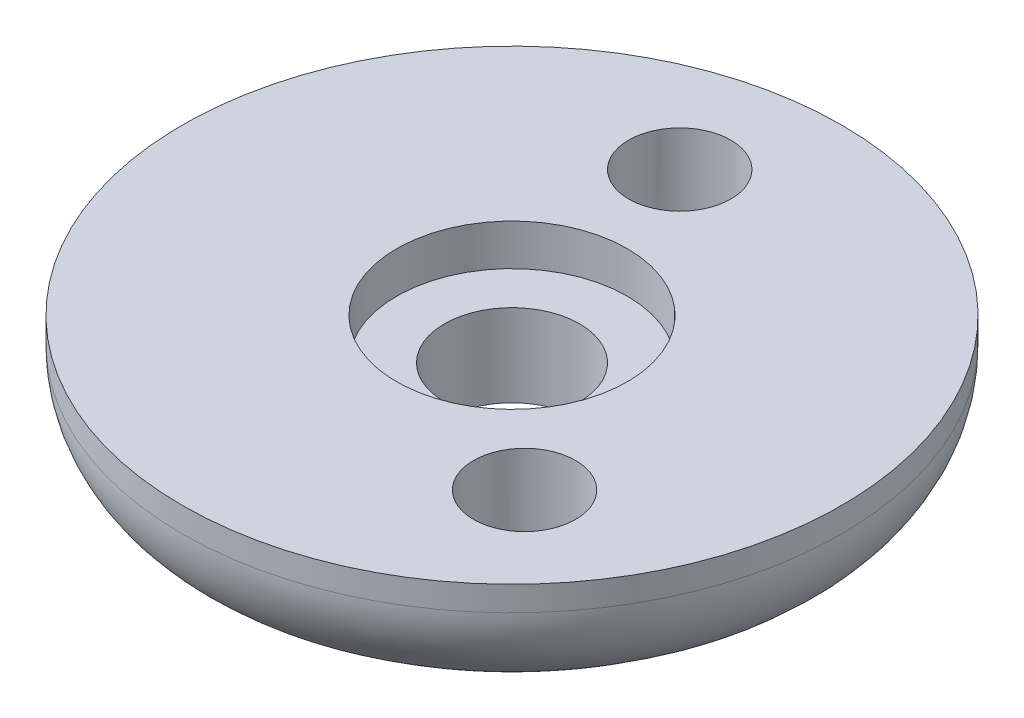
from build123d import *

# Parameters (mm, degrees)
BOSS_EXTRUDE1_DEPTH        = 3
BOSS_EXTRUDE1_DEPTH_BACK   = 10
SKETCH1_R                  = 10
SKETCH4_R                  = 1.5
HOLE_DEPTH                 = 20.973741561
HOLECIR_COUNT              = 5
SKETCH6_R                  = 3.5
BEARINGHOLE_DEPTH          = 2.5
SKETCH7_R                  = 2.05
SHAFTHOLE_DEPTH            = 17.248076982
F_3_1_3_1_DIAMETER_HOLE1_D = 3.1
FILLET2_R                  = 3
SKETCH11_R                 = 10
CUT_EXTRUDE1_DEPTH         = 10


with BuildPart() as part:
    # Sketch1 → Boss-Extrude1 (new, two sides: drawn at the far end of the back side and taken through both)
    with BuildSketch(Plane(origin=(0, 0, 0), x_dir=(1, 0, 0), z_dir=(0, 1, 0)).offset(-BOSS_EXTRUDE1_DEPTH_BACK)):
        with Locations(Location((0, 0, 0), (0, 0, 270))):
            Circle(SKETCH1_R)
    extrude(amount=BOSS_EXTRUDE1_DEPTH + BOSS_EXTRUDE1_DEPTH_BACK)

    # Sketch4 → hole (cut, through all)
    with BuildSketch(Plane(origin=(-3.352872105, -1.093066116, 1.887711608), x_dir=(-0.4486862613641547, -0.14627571033740308, -0.8816371449912632), z_dir=(0.8382180262940947, 0.2732665289126682, -0.47192790187872385))):
        with Locations(Location((0, 0, 0), (0, 0, 8.746528197))):
            Circle(SKETCH4_R)
    hole = extrude(amount=-HOLE_DEPTH, mode=Mode.SUBTRACT)

    # holecir: hole ×5 about axis
    holecir_axis = Axis((0, 0, 0), (0, 1, 0))
    for i in range(1, HOLECIR_COUNT):
        add(hole.rotate(holecir_axis, i * 360 / HOLECIR_COUNT), mode=Mode.SUBTRACT)

    # Sketch6 → bearinghole (cut)
    with BuildSketch(Plane(origin=(0, -5, 0), x_dir=(-1, 0, 0), z_dir=(0, -1, 0))):
        with Locations(Location((0, 0, 0), (0, 0, 90))):
            Circle(SKETCH6_R)
    extrude(amount=BEARINGHOLE_DEPTH, mode=Mode.SUBTRACT)

    # Sketch7 → shafthole (cut, through all)
    with BuildSketch(Plane(origin=(0, -5, 0), x_dir=(-1, 0, 0), z_dir=(0, -1, 0))):
        with Locations(Location((0, 0, 0), (0, 0, 90))):
            Circle(SKETCH7_R)
    extrude(amount=SHAFTHOLE_DEPTH, mode=Mode.SUBTRACT)

    # Ø3.1 (3.1) Diameter Hole1 (through all)
    with Locations(Plane(origin=(0, 3, 0), x_dir=(1, 0, 0), z_dir=(0, 1, 0))):
        with Locations((-1.282558474, 6.372208703), (4.783101903, -4.401356176)):
            Hole(F_3_1_3_1_DIAMETER_HOLE1_D / 2)

    # Fillet2
    # the kernel refuses this fillet: 3 mm, written as the material it takes off along each edge
    with BuildSketch(Plane(origin=(0, 3, 0), x_dir=(0, 0, 1), z_dir=(-1, 0, 0))) as fillet2_piece_1:
        with BuildLine():
            CenterArc((10 - FILLET2_R, -FILLET2_R), FILLET2_R, 0, 90)
            Line((10 - FILLET2_R, 0), (10, 0))
            Line((10, 0), (10, -FILLET2_R))
        make_face()
    revolve(axis=Axis((0, 3, 0), (0, 1, 0)), mode=Mode.SUBTRACT)
    with BuildSketch(Plane(origin=(0, -10, 0), x_dir=(0, 0, 1), z_dir=(-1, 0, 0))) as fillet2_piece_2:
        with BuildLine():
            CenterArc((10 - FILLET2_R, FILLET2_R), FILLET2_R, 270, 90)
            Line((10 - FILLET2_R, 0), (10, 0))
            Line((10, 0), (10, FILLET2_R))
        make_face()
    revolve(axis=Axis((0, -10, 0), (0, 1, 0)), mode=Mode.SUBTRACT)

    # Sketch11 → Cut-Extrude1 (cut)
    with BuildSketch(Plane(origin=(0, -6.25, 0), x_dir=(-1, 0, 0), z_dir=(0, -1, 0))):
        with Locations(Location((0, 0, 0), (0, 0, 270))):
            Circle(SKETCH11_R)
    extrude(amount=-CUT_EXTRUDE1_DEPTH, mode=Mode.SUBTRACT)


solid = part.part
